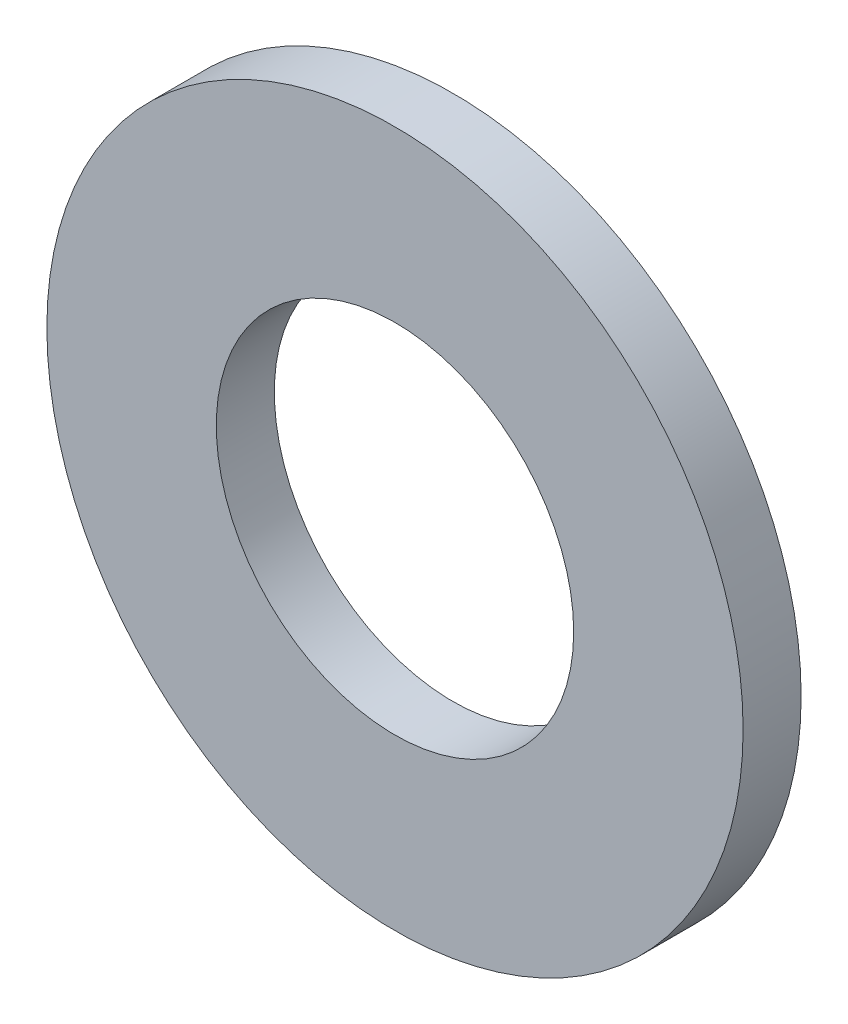
from build123d import *

# Parameters (mm, degrees)
SKETCH1_R           = 9.525
SKETCH1_R_2         = 4.8895
BOSS_EXTRUDE1_DEPTH = 1.5875


with BuildPart() as part:
    # Sketch1 → Boss-Extrude1 (new body)
    with BuildSketch(Plane.XY):
        Circle(SKETCH1_R)
        Circle(SKETCH1_R_2, mode=Mode.SUBTRACT)
    extrude(amount=BOSS_EXTRUDE1_DEPTH)


solid = part.part
